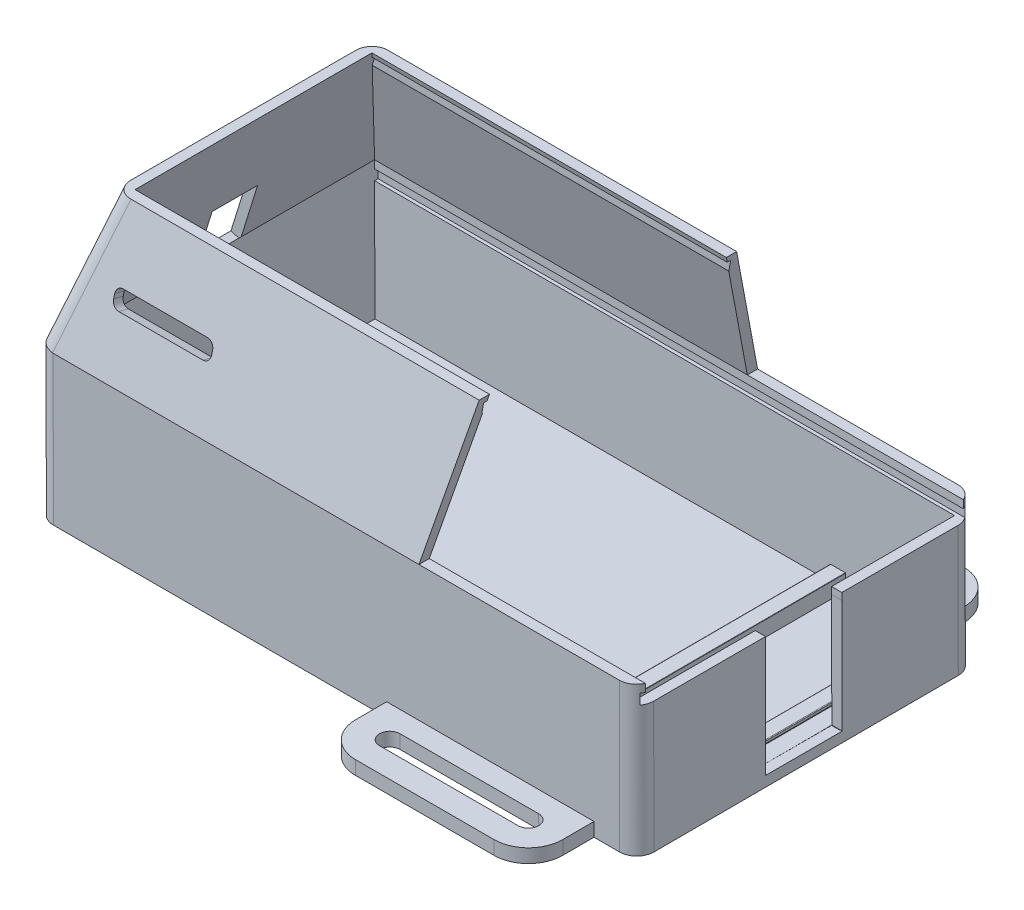
from build123d import *
from OCP.BRepAlgoAPI import BRepAlgoAPI_Cut
from OCP.TopTools import TopTools_ListOfShape

# Parameters (mm, degrees)
SKETCH1_W            = 175.025590169
SKETCH1_H            = 98.699761336
BOSS_EXTRUDE1_DEPTH  = 3
SKETCH2_W            = 175.025590169
SKETCH2_H            = 98.699761336
SKETCH2_W_2          = 169.025590169
SKETCH2_H_2          = 92.699761336
BOSS_EXTRUDE2_DEPTH  = 35.5
BOSS_EXTRUDE3_DEPTH  = 80
CUT_EXTRUDE1_DEPTH   = 3
BOSS_EXTRUDE18_REACH = 231.088
CUT_EXTRUDE2_DEPTH   = 172.025590169
CUT_EXTRUDE6_DEPTH   = 10
CUT_EXTRUDE9_REACH   = 273.858
SKETCH20_W           = 55.04
SKETCH20_H           = 1.6
SKETCH20_W_2         = 71.993551849
SKETCH20_H_2         = 3
SKETCH21_W           = 13.268982054
SKETCH21_H           = 16.981220693
CUT_EXTRUDE10_DEPTH  = 2.864894477
CUT_EXTRUDE11_DEPTH  = 2.899295446
FILLET1_R            = 5
BOSS_EXTRUDE21_DEPTH = 4


with BuildPart() as part:
    # Sketch1 → Boss-Extrude1 (new body)
    with BuildSketch(Plane(origin=(0, 35.362227101, 0.081123263), x_dir=(1, 0, 0), z_dir=(6.9833353168161736e-15, -0.9999973686422646, -0.002294059403524814))):
        with Locations((57.415956998, 123.751717011)):
            Rectangle(SKETCH1_W, SKETCH1_H)
    extrude(amount=BOSS_EXTRUDE1_DEPTH)

    # Sketch2 → Boss-Extrude2 (add)
    with BuildSketch(Plane(origin=(0, 35.362227101, 0.081123263), x_dir=(1, 0, 0), z_dir=(-6.991181572878775e-15, 0.9999973686422646, 0.0022940594035248327))):
        with Locations((57.415956998, -123.751717011)):
            Rectangle(SKETCH2_W, SKETCH2_H)
        with Locations((57.415956998, -123.751717011)):
            Rectangle(SKETCH2_W_2, SKETCH2_H_2, mode=Mode.SUBTRACT)
    extrude(amount=BOSS_EXTRUDE2_DEPTH)

    # Sketch4 → Boss-Extrude3 (add)
    with BuildSketch(Plane(origin=(0, -0.170682232, 74.401640566), x_dir=(-1, 0, 0), z_dir=(0, 0.0022940594035248145, -0.9999973686422646))):
        with BuildLine():
            Line((-137.125595462, 33.362320152), (-137.125595462, 38.762320152))
            ThreePointArc((-137.125595462, 38.762320152), (-137.154884784, 38.83303083), (-137.225595462, 38.862320152))
            Line((-137.225595462, 38.862320152), (-140.437886876, 38.862320152))
            ThreePointArc((-140.437886876, 38.862320152), (-140.571564636, 38.925046414), (-140.625972803, 39.062320152))
            Line((-140.625972803, 39.062320152), (-140.625595462, 39.662320152))
            ThreePointArc((-140.625595462, 39.662320152), (-140.567016818, 39.803741508), (-140.425595462, 39.862320152))
            Line((-140.425595462, 39.862320152), (-136.225595462, 39.862320152))
            ThreePointArc((-136.225595462, 39.862320152), (-136.154884784, 39.83303083), (-136.125595462, 39.762320152))
            Line((-136.125595462, 39.762320152), (-136.125595462, 33.962320152))
            ThreePointArc((-136.125595462, 33.962320152), (-136.09630614, 33.891609474), (-136.025595462, 33.862320152))
            Line((-136.025595462, 33.862320152), (-110.225595462, 33.862320152))
            ThreePointArc((-110.225595462, 33.862320152), (-110.154884784, 33.891609474), (-110.125595462, 33.962320152))
            Line((-110.125595462, 33.962320152), (-110.125595462, 39.762320152))
            ThreePointArc((-110.125595462, 39.762320152), (-110.09630614, 39.83303083), (-110.025595462, 39.862320152))
            Line((-110.025595462, 39.862320152), (-105.825595462, 39.862320152))
            ThreePointArc((-105.825595462, 39.862320152), (-105.684174106, 39.803741508), (-105.625595462, 39.662320152))
            Line((-105.625595462, 39.662320152), (-105.625595462, 39.062320152))
            ThreePointArc((-105.625595462, 39.062320152), (-105.684174106, 38.920898796), (-105.825595462, 38.862320152))
            Line((-105.825595462, 38.862320152), (-109.025595462, 38.862320152))
            ThreePointArc((-109.025595462, 38.862320152), (-109.09630614, 38.83303083), (-109.125595462, 38.762320152))
            Line((-109.125595462, 38.762320152), (-109.125595462, 33.362320152))
            Line((-109.125595462, 33.362320152), (-109.125595462, 32.362320152))
            Line((-109.125595462, 32.362320152), (-137.125595462, 32.362320152))
            Line((-137.125595462, 32.362320152), (-137.125595462, 33.362320152))
        make_face()
    extrude(amount=-BOSS_EXTRUDE3_DEPTH)

    # Sketch5 → Cut-Extrude1 (cut)
    with BuildSketch(Plane(origin=(144.928752082, 0, 0), x_dir=(0, 0, -1), z_dir=(1, 0, 0))):
        Polygon((-135.647864414, 70.612709498), (-135.647864414, 64.800669259), (-135.65072397, 64.797804586), (-135.647864414, 63.551303119), (-135.647864414, 35.046511612), (-113.408223309, 35.046511612), (-113.408223309, 35.092257349), (-113.332519351, 35.092431019), (-113.408223309, 68.092343044), (-113.408223309, 70.612709498), align=None)
    extrude(amount=-CUT_EXTRUDE1_DEPTH, mode=Mode.SUBTRACT)

    # Boss-Extrude18: up to this plane
    boss_extrude18_end = Plane(origin=(59.321367117, 75.402979661, 91.193626143), z_dir=(0, 1, 0))
    # Sketch13 → Boss-Extrude18 (add, up to the surface)
    with BuildSketch(Plane(origin=(0, 70.862133688, 0.162562372), x_dir=(1, 0, 0), z_dir=(-8.261822211046718e-15, 0.9999973686422646, 0.002294059403524814)), mode=Mode.PRIVATE) as boss_extrude18_sk1:
        Polygon((141.928752082, -113.245958928), (144.928752082, -113.245958928), (144.928752082, -74.401836343), (-30.096838087, -74.401836343), (-30.096838087, -173.101597679), (144.928752082, -173.101597679), (144.928752082, -135.485658553), (141.928752082, -135.485658553), (141.928752082, -170.101597679), (-27.096838087, -170.101597679), (-27.096838087, -77.401836343), (141.928752082, -77.401836343), align=None)
    boss_extrude18_tool1 = split(extrude(boss_extrude18_sk1.sketch, amount=BOSS_EXTRUDE18_REACH, mode=Mode.PRIVATE), bisect_by=boss_extrude18_end, keep=Keep.BOTH, mode=Mode.PRIVATE)
    add(boss_extrude18_tool1.solids().sort_by_distance((143.428752, 70.60695, 111.398861))[0])

    # Sketch14 → Cut-Extrude2 (cut)
    with BuildSketch(Plane(origin=(144.928752082, 0, 0), x_dir=(0, 0, -1), z_dir=(1, 0, 0))):
        Polygon((-135.647864414, 70.551321539), (-135.653718085, 73.102979661), (-169.269745666, 73.102979661), (-171.269745666, 73.102979661), (-171.269745666, 70.102979661), (-135.647864414, 70.102979661), align=None)
        Polygon((-76.569745666, 73.102979661), (-78.569745666, 73.102979661), (-113.413959938, 73.102979661), (-113.408223309, 70.602340731), (-113.408223309, 70.102979661), (-76.569745666, 70.102979661), align=None)
        Polygon((-113.408223309, 70.602340731), (-113.413959938, 73.102979661), (-135.653718085, 73.102979661), (-135.647864414, 70.551321539), (-135.647864414, 70.102979661), (-113.408223309, 70.102979661), align=None)
    extrude(amount=-CUT_EXTRUDE2_DEPTH, mode=Mode.SUBTRACT)

    # Sketch15 → Cut-Extrude6 (cut)
    with BuildSketch(Plane(origin=(144.928752082, 0, 0), x_dir=(0, 0, -1), z_dir=(1, 0, 0))):
        Polygon((-113.419236289, 75.402979661), (-113.413959938, 73.102979661), (-77.569743035, 73.102979661), (-77.575019386, 75.402979661), align=None)
        Polygon((-135.653718085, 73.102979661), (-170.269748298, 73.102979661), (-170.275024648, 75.402979661), (-135.653718085, 75.402979661), align=None)
    extrude(amount=-CUT_EXTRUDE6_DEPTH, mode=Mode.SUBTRACT)

    # Loft1: read off the stored shape, not the designer's step
    # Loft1: loft between two sections, ruled curve by curve
    loft1_from = [
        Edge.make_line((-30.096838087, 75.402979661, 173.275032542), (81.538428177, 75.402979661, 173.275032542)),
        Edge.make_line((81.538428177, 75.402979661, 173.275032542), (81.538428177, 75.402979661, 170.275024648)),
        Edge.make_line((81.53842818, 75.402979661, 77.575019386), (81.53842818, 75.402979661, 74.575011492)),
        Edge.make_line((81.538428177, 75.402979661, 170.275024648), (-27.096838087, 75.402979661, 170.275024648)),
        Edge.make_line((-27.096838087, 75.402979661, 170.275024648), (-27.096838087, 75.402979661, 77.575019386)),
        Edge.make_line((-27.096838087, 75.402979661, 77.575019386), (81.53842818, 75.402979661, 77.575019386)),
        Edge.make_line((81.53842818, 75.402979661, 74.575011492), (-30.096838087, 75.402979661, 74.575011492)),
        Edge.make_line((-30.096838087, 75.402979661, 74.575011492), (-30.096838087, 75.402979661, 173.275032542)),
    ]
    loft1_to = [
        Edge.make_line((-17.76157182, 115.102979661, 162.720669643), (88.538428181, 115.102979661, 162.720669643)),
        Edge.make_line((88.538428181, 115.102979661, 162.720669643), (88.538428181, 115.102979661, 159.720669643)),
        Edge.make_line((88.538428181, 115.102979661, 90.680669643), (88.538428181, 115.102979661, 87.680669643)),
        Edge.make_line((88.538428181, 115.102979661, 159.720669643), (-14.761571819, 115.102979661, 159.720669643)),
        Edge.make_line((-14.761571819, 115.102979661, 159.720669643), (-14.761571819, 115.102979661, 90.680669643)),
        Edge.make_line((-14.761571819, 115.102979661, 90.680669643), (88.538428181, 115.102979661, 90.680669643)),
        Edge.make_line((88.538428181, 115.102979661, 87.680669643), (-17.76157182, 115.102979661, 87.680669643)),
        Edge.make_line((-17.76157182, 115.102979661, 87.680669643), (-17.76157182, 115.102979661, 162.720669643)),
    ]
    loft1 = Solid(Shell([*[Face.make_surface_from_curves(loft1_from[k], loft1_to[k]) for k in range(8)], Face(Wire(loft1_from)), Face(Wire(loft1_to))]))
    add(loft1)

    # Cut-Extrude9: up to this plane
    cut_extrude9_end = Plane(origin=(-14.761571819, 115.102979661, 90.680669643), z_dir=(0.9549648258216218, -0.2967190277745592, 0))
    # Sketch20 → Cut-Extrude9 (cut, up to the surface)
    with BuildSketch(Plane(origin=(144.928752082, 0, 0), x_dir=(0, 0, -1), z_dir=(1, 0, 0)), mode=Mode.PRIVATE) as cut_extrude9_sk1:
        with Locations((-125.200669643, 114.302979661)):
            Rectangle(SKETCH20_W, SKETCH20_H)
    cut_extrude9_tool1 = split(extrude(cut_extrude9_sk1.sketch, amount=-CUT_EXTRUDE9_REACH, mode=Mode.PRIVATE), bisect_by=cut_extrude9_end, keep=Keep.BOTH, mode=Mode.PRIVATE)
    add(cut_extrude9_tool1.solids().sort_by_distance((144.928752, 114.30298, 125.20067))[0], mode=Mode.SUBTRACT)
    # Sketch20 → Cut-Extrude9 (cut, up to the surface)
    with BuildSketch(Plane(origin=(144.928752082, 0, 0), x_dir=(0, 0, -1), z_dir=(1, 0, 0)), mode=Mode.PRIVATE) as cut_extrude9_sk2:
        with Locations((-125.149258153, 112.002979661)):
            Rectangle(SKETCH20_W_2, SKETCH20_H_2)
    cut_extrude9_tool2 = split(extrude(cut_extrude9_sk2.sketch, amount=-CUT_EXTRUDE9_REACH, mode=Mode.PRIVATE), bisect_by=cut_extrude9_end, keep=Keep.BOTH, mode=Mode.PRIVATE)
    add(cut_extrude9_tool2.solids().sort_by_distance((144.928752, 112.00298, 125.149258))[0], mode=Mode.SUBTRACT)

    # Sketch21 → Cut-Extrude10 (cut)
    with BuildSketch(Plane(origin=(-48.812951207, 15.166769532, 0), x_dir=(0, 0, 1), z_dir=(-0.9549648258269783, 0.2967190277573198, -6.667019861839508e-15))):
        with Locations((123.069403721, 71.56749915)):
            Rectangle(SKETCH21_W, SKETCH21_H)
    extrude(amount=-CUT_EXTRUDE10_DEPTH, mode=Mode.SUBTRACT)


with BuildPart() as cut_extrude11_tool:
    # Sketch22 → Cut-Extrude11 (new body)
    with BuildSketch(Plane(origin=(0, 48.002301666, 180.559584161), x_dir=(1, 0, 0), z_dir=(-1.1871401813108906e-14, 0.2569284026079074, 0.9664304402973601))):
        with BuildLine():
            Line((-10.196838087, 49.992354943), (14.343161913, 49.992354943))
            ThreePointArc((14.343161913, 49.992354943), (15.757375475, 49.406568505), (16.343161913, 47.992354943))
            Line((16.343161913, 47.992354943), (16.343161913, 46.78671544))
            ThreePointArc((16.343161913, 46.78671544), (15.757375475, 45.372501878), (14.343161913, 44.78671544))
            Line((14.343161913, 44.78671544), (-10.196838087, 44.78671544))
            ThreePointArc((-10.196838087, 44.78671544), (-11.611051649, 45.372501878), (-12.196838087, 46.78671544))
            Line((-12.196838087, 46.78671544), (-12.196838087, 47.992354943))
            ThreePointArc((-12.196838087, 47.992354943), (-11.611051649, 49.406568505), (-10.196838087, 49.992354943))
        make_face()
    extrude(amount=-CUT_EXTRUDE11_DEPTH)


with BuildPart() as part_1:
    add(part.part)

    # Cut-Extrude11: cut by cut_extrude11_tool, with a tolerance
    cut_extrude11_stock = TopTools_ListOfShape()
    cut_extrude11_stock.Append(part_1.part.wrapped)
    cut_extrude11_tools = TopTools_ListOfShape()
    cut_extrude11_tools.Append(cut_extrude11_tool.part.wrapped)
    cut_extrude11_cut = BRepAlgoAPI_Cut()
    cut_extrude11_cut.SetArguments(cut_extrude11_stock)
    cut_extrude11_cut.SetTools(cut_extrude11_tools)
    cut_extrude11_cut.SetFuzzyValue(0.00001)
    cut_extrude11_cut.Build()
    add(Compound.cast(cut_extrude11_cut.Shape()).solids(), mode=Mode.REPLACE)

    # Fillet1
    # the kernel refuses this fillet: 5 mm, written as the material it takes off along each edge
    with BuildSketch(Plane(origin=(144.928752082, 87.902946769, 173.303708285), x_dir=(-2.842170943040428e-14, 0.0022940594035265596, -0.9999973686422645), z_dir=(1.3086114820877341e-15, -0.9999973686422645, -0.0022940594035265596))) as fillet1_piece_1:
        with BuildLine():
            CenterArc((FILLET1_R, -FILLET1_R), FILLET1_R, 90, 90)
            Line((0, -FILLET1_R), (0, 0))
            Line((0, 0), (FILLET1_R, 0))
        make_face()
    fillet1_piece_1_solid = extrude(amount=68.437964315, mode=Mode.PRIVATE)
    with BuildSketch(Plane(origin=(144.928752082, 19.691585655, 74.447205908), x_dir=(0, -0.002294059403524528, 0.9999973686422645), z_dir=(-7.235076541341869e-15, 0.9999973686422646, 0.002294059403524528))) as fillet1_piece_2:
        with BuildLine():
            CenterArc((FILLET1_R, -FILLET1_R), FILLET1_R, 90, 90)
            Line((0, -FILLET1_R), (0, 0))
            Line((0, 0), (FILLET1_R, 0))
        make_face()
    fillet1_piece_2_solid = extrude(amount=68.211540603, mode=Mode.PRIVATE)
    with BuildSketch(Plane(origin=(-35.574773459, 57.772712947, 68.754954851), x_dir=(0.9591228921497503, -0.2687259220295025, -0.08871108489750493), z_dir=(0.2829898898446702, 0.9107787690719829, 0.30066385890795916))) as fillet1_piece_3:
        with BuildLine():
            CenterArc((FILLET1_R * 0.9109342886, -FILLET1_R), FILLET1_R, 90, 84.662925908)
            Line((-FILLET1_R * 0.0847304313661, -FILLET1_R * 0.906985133366), (0, 0))
            Line((0, 0), (FILLET1_R * 0.9109342886, 0))
        make_face()
    fillet1_piece_3_solid = extrude(amount=74.333102768, mode=Mode.PRIVATE)
    with BuildSketch(Plane(origin=(-35.758808566, 57.180411689, 178.119556354), x_dir=(0.9577520410970738, -0.27794080400398097, 0.07389138815863325), z_dir=(0.287595249916248, 0.9256007267731117, -0.24607370201364104))) as fillet1_piece_4:
        with BuildLine():
            CenterArc((FILLET1_R * 0.926460606246, FILLET1_R), FILLET1_R, 184.372217137, 85.627782863)
            Line((-FILLET1_R * 0.0706292300039, FILLET1_R * 0.923764454174), (0, 0))
            Line((0, 0), (FILLET1_R * 0.926460606246, 0))
        make_face()
    fillet1_piece_4_solid = extrude(amount=74.159109449, mode=Mode.PRIVATE)
    with BuildSketch(Plane(origin=(-30.096838087, 96.652923745, 173.323781305), x_dir=(1, 0, 0), z_dir=(6.951998498590891e-15, -0.9999973686422645, -0.0022940594035271494))) as fillet1_piece_5:
        with BuildLine():
            CenterArc((FILLET1_R, -FILLET1_R), FILLET1_R, 90, 90)
            Line((0, -FILLET1_R), (0, 0))
            Line((0, 0), (FILLET1_R, 0))
        make_face()
    fillet1_piece_5_solid = extrude(amount=77.187964315, mode=Mode.PRIVATE)
    with BuildSketch(Plane(origin=(-30.096838087, 19.691585655, 74.447205908), x_dir=(1, 0, 0), z_dir=(-7.070642983583899e-15, 0.9999973686422646, 0.0022940594035247915))) as fillet1_piece_6:
        with BuildLine():
            CenterArc((FILLET1_R, -FILLET1_R), FILLET1_R, 90, 90)
            Line((0, -FILLET1_R), (0, 0))
            Line((0, 0), (FILLET1_R, 0))
        make_face()
    fillet1_piece_6_solid = extrude(amount=76.961540603, mode=Mode.PRIVATE)
    add([fillet1_piece_1_solid, fillet1_piece_2_solid, fillet1_piece_3_solid, fillet1_piece_4_solid, fillet1_piece_5_solid, fillet1_piece_6_solid], mode=Mode.SUBTRACT)

    # Sketch25 → Boss-Extrude21 (add)
    with BuildSketch(Plane(origin=(0, 32.362234995, 0.074241085), x_dir=(1, 0, 0), z_dir=(6.977506045685946e-15, -0.9999973686422646, -0.002294059403524763))):
        with BuildLine():
            Line((132.461015957, 65.298831473), (132.461015957, 74.401836343))
            Line((132.461015957, 74.401836343), (72.0312592, 74.401836343))
            Line((72.0312592, 74.401836343), (72.0312592, 65.298831473))
            ThreePointArc((72.0312592, 65.298831473), (74.960191388, 58.227763661), (82.0312592, 55.298831473))
            Line((82.0312592, 55.298831473), (122.461015957, 55.298831473))
            ThreePointArc((122.461015957, 55.298831473), (129.532083769, 58.227763661), (132.461015957, 65.298831473))
        make_face()
        with BuildLine():
            ThreePointArc((122.461015957, 68.298831473), (125.461015957, 65.298831473), (122.461015957, 62.298831473))
            Line((122.461015957, 62.298831473), (82.0312592, 62.298831473))
            ThreePointArc((82.0312592, 62.298831473), (79.0312592, 65.298831473), (82.0312592, 68.298831473))
            Line((82.0312592, 68.298831473), (122.461015957, 68.298831473))
        make_face(mode=Mode.SUBTRACT)
    boss_extrude21 = extrude(amount=-BOSS_EXTRUDE21_DEPTH)

    # Mirror2: Boss-Extrude21 across plane
    add(boss_extrude21.mirror(Plane(origin=(0, -0.28389379, 123.751391376), x_dir=(1, 0, 0), z_dir=(0, 0.0022940594035248145, -0.9999973686422646))))


solid = part_1.part
